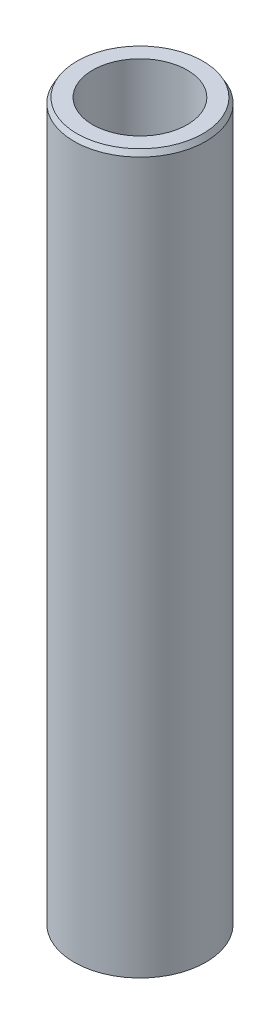
from build123d import *
from OCP.BRepFilletAPI import BRepFilletAPI_MakeChamfer

# Parameters (mm, degrees)
SKETCH1_R           = 55
BOSS_EXTRUDE1_DEPTH = 600
SKETCH2_R           = 39.489682725
CUT_EXTRUDE1_DEPTH  = 606.020660804
CHAMFER1_SIZE       = 4.286848957
CHAMFER1_SIZE2      = 2.475013399


with BuildPart() as part:
    # Sketch1 → Boss-Extrude1 (new body)
    with BuildSketch(Plane(origin=(0, 0, 0), x_dir=(1, 0, 0), z_dir=(0, 1, 0))):
        Circle(SKETCH1_R)
    extrude(amount=BOSS_EXTRUDE1_DEPTH)

    # Sketch2 → Cut-Extrude1 (cut, through all)
    with BuildSketch(Plane(origin=(0, 0, 0), x_dir=(1, 0, 0), z_dir=(0, 1, 0))):
        Circle(SKETCH2_R)
    extrude(amount=CUT_EXTRUDE1_DEPTH, mode=Mode.SUBTRACT)

    # Chamfer1: one chamfer whose edges measure the first distance from different faces: ONE call of the kernel's chamfer builder (chamfer() names one face for all edges)
    chamfer1_edges_1 = [part.edges().sort_by_distance(p)[0] for p in [
        (-55, 600, 0),
    ]]
    chamfer1_side_1 = [part.faces().sort_by_distance(p)[0] for p in [
        (-55, 300, 0),
    ]]
    chamfer1_edges_2 = [part.edges().sort_by_distance(p)[0] for p in [
        (-55, 0, 0),
    ]]
    chamfer1_side_2 = [part.faces().sort_by_distance(p)[0] for p in [
        (-53.444365081, 0, 0),
    ]]
    chamfer1 = BRepFilletAPI_MakeChamfer(part.part.solid().wrapped)
    for e in chamfer1_edges_1:
        chamfer1.Add(CHAMFER1_SIZE, CHAMFER1_SIZE2, e.wrapped, chamfer1_side_1[0].wrapped)  # the first distance lies on this face
    for e in chamfer1_edges_2:
        chamfer1.Add(CHAMFER1_SIZE, CHAMFER1_SIZE2, e.wrapped, chamfer1_side_2[0].wrapped)  # the first distance lies on this face
    add(Compound.cast(chamfer1.Shape()), mode=Mode.REPLACE)


solid = part.part
